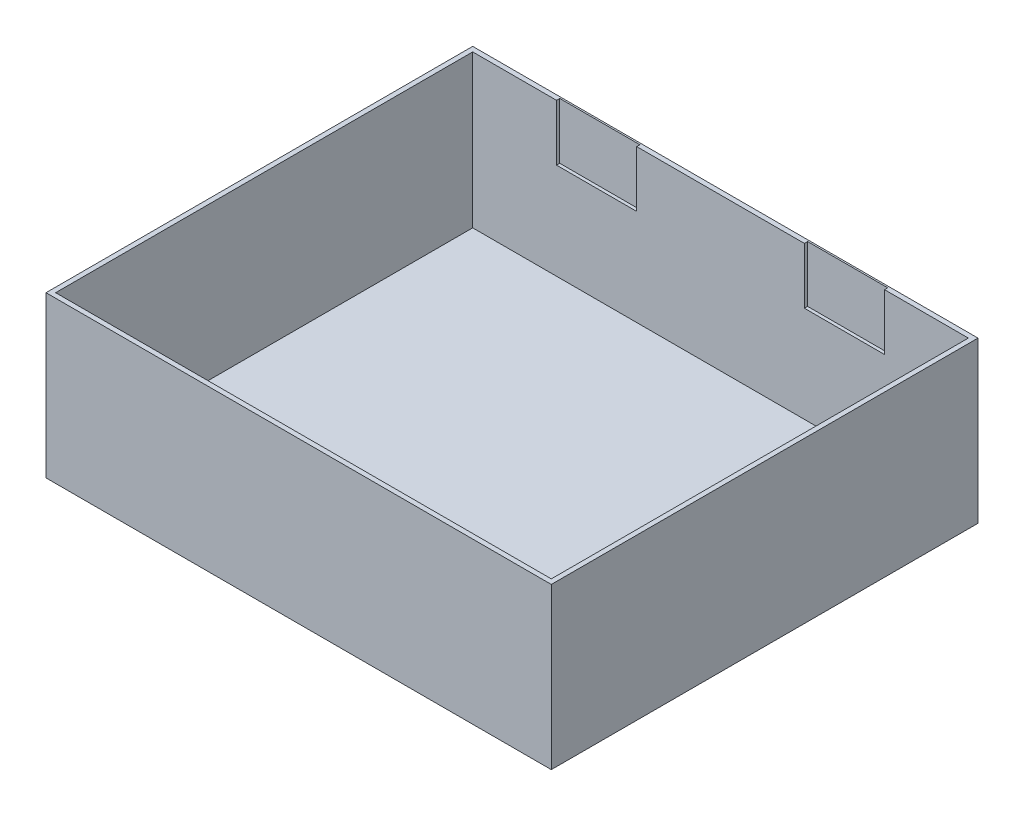
from build123d import *

# Parameters (mm, degrees)
SKETCH1_W           = 315
SKETCH1_H           = 266
BOSS_EXTRUDE1_DEPTH = 100
SHELL1_START        = -154.5
SHELL1_OUTLINE_W    = 92
SHELL1_OUTLINE_H    = 260
SHELL1_DEPTH        = 309
SKETCH2_W           = 309
SKETCH2_H           = 260
CUT_EXTRUDE1_DEPTH  = 3
SKETCH5_W           = 50
SKETCH5_H           = 35
CUT_EXTRUDE3_DEPTH  = 2


# Read off the part's stored shape, not the designer's step: Shell1
with BuildPart() as part:
    # Sketch1 → Boss-Extrude1 (new body)
    with BuildSketch(Plane(origin=(0, 0, 0), x_dir=(1, 0, 0), z_dir=(0, 1, 0))):
        Rectangle(SKETCH1_W, SKETCH1_H)
    extrude(amount=BOSS_EXTRUDE1_DEPTH)

    # Shell1 outline → Shell1 (cut)
    with BuildSketch(Plane.YZ.offset(SHELL1_START)):
        with Locations((51, 0)):
            Rectangle(SHELL1_OUTLINE_W, SHELL1_OUTLINE_H)
    extrude(amount=SHELL1_DEPTH, mode=Mode.SUBTRACT)

    # Sketch2 → Cut-Extrude1 (cut)
    with BuildSketch(Plane(origin=(0, 100, 0), x_dir=(1, 0, 0), z_dir=(0, 1, 0))):
        Rectangle(SKETCH2_W, SKETCH2_H)
    extrude(amount=-CUT_EXTRUDE1_DEPTH, mode=Mode.SUBTRACT)

    # Sketch5 → Cut-Extrude3 (cut)
    with BuildSketch(Plane.XY.offset(-130)):
        with Locations((-77.25, 82.5)):
            Rectangle(SKETCH5_W, SKETCH5_H)
    cut_extrude3 = extrude(amount=-CUT_EXTRUDE3_DEPTH, mode=Mode.SUBTRACT)

    # Mirror1: Cut-Extrude3 across plane
    add(cut_extrude3.mirror(Plane(origin=(0, 0, 0), x_dir=(0, 0, 1), z_dir=(1, 0, 0))), mode=Mode.SUBTRACT)


solid = part.part
